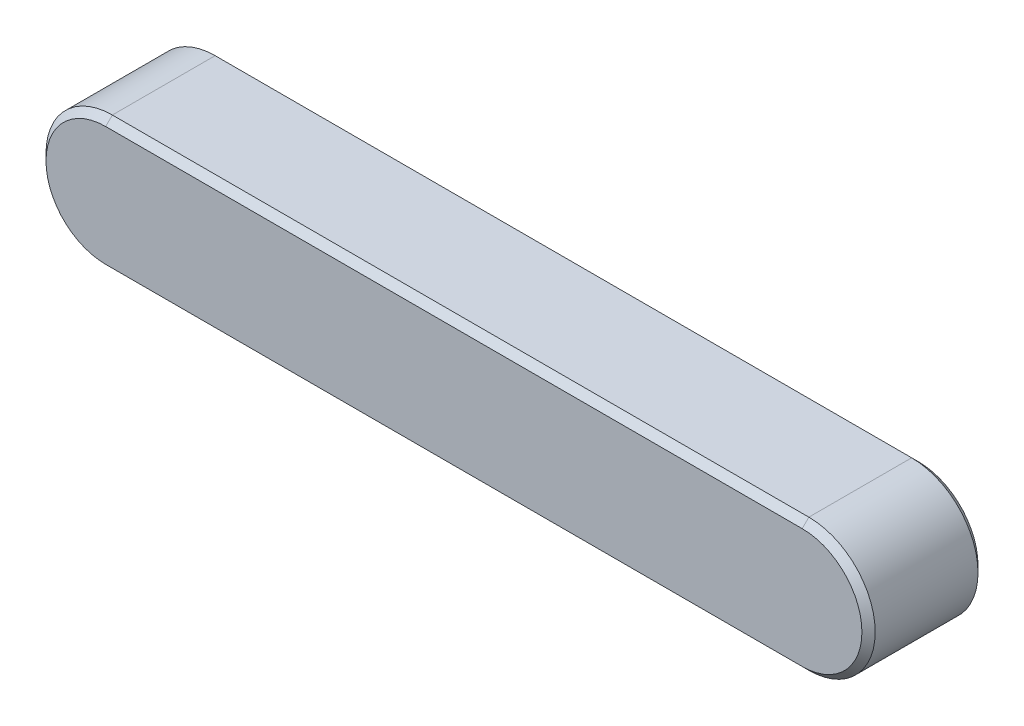
from build123d import *

# Parameters (mm, degrees)
EXTRUDE1_DEPTH = 7
CHAMFER1_SIZE  = 0.4


with BuildPart() as part:
    # body → Extrude1 (new body)
    with BuildSketch(Plane.XY):
        with BuildLine():
            ThreePointArc((42, 0), (46, 4), (42, 8))
            Line((42, 8), (0, 8))
            ThreePointArc((0, 8), (-4, 4), (0, 0))
            Line((0, 0), (42, 0))
        make_face()
    extrude(amount=EXTRUDE1_DEPTH)

    # Chamfer1
    chamfer1_edges = [part.edges().sort_by_distance(p)[0] for p in [
        (-4, 4, 0),
        (21, 0, 0),
        (46, 4, 0),
        (21, 8, 0),
        (46, 4, 7),
        (21, 0, 7),
        (-4, 4, 7),
        (21, 8, 7),
    ]]
    chamfer(chamfer1_edges, length=CHAMFER1_SIZE)


solid = part.part
